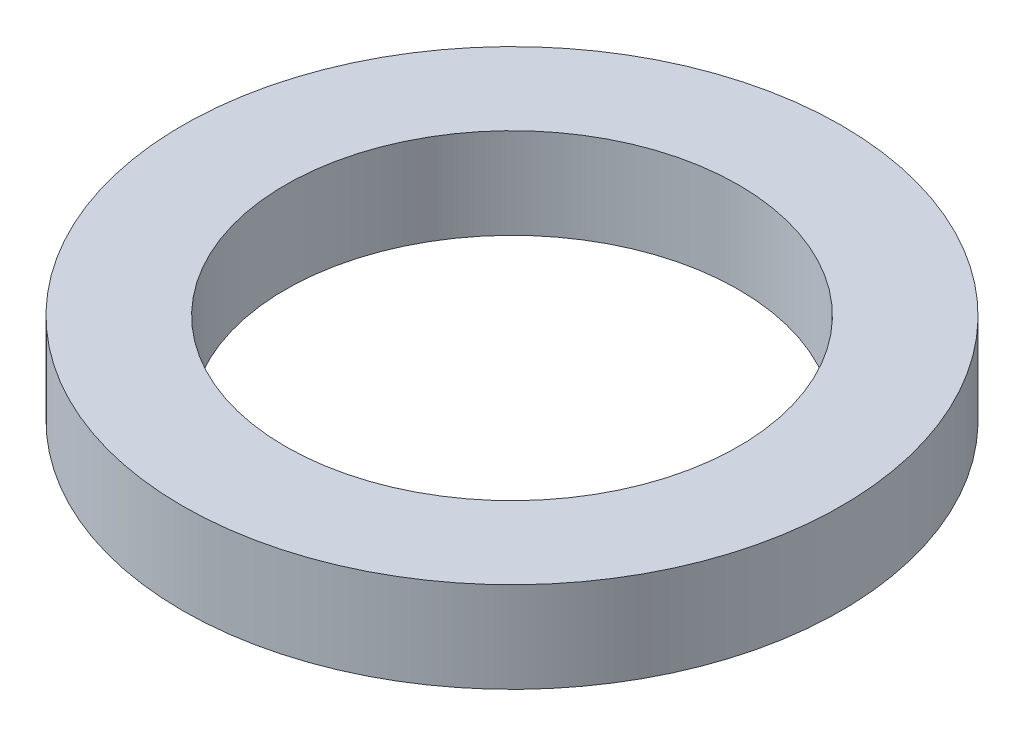
from build123d import *

# Parameters (mm, degrees)
SKETCH1_R           = 40
BOSS_EXTRUDE1_DEPTH = 11
SKETCH2_R           = 27.5
CUT_EXTRUDE1_DEPTH  = 58.628118137


with BuildPart() as part:
    # Sketch1 → Boss-Extrude1 (new body)
    with BuildSketch(Plane(origin=(0, 0, 0), x_dir=(1, 0, 0), z_dir=(0, 1, 0))):
        Circle(SKETCH1_R)
    extrude(amount=BOSS_EXTRUDE1_DEPTH)

    # Sketch2 → Cut-Extrude1 (cut, through all)
    with BuildSketch(Plane(origin=(0, 0, 0), x_dir=(1, 0, 0), z_dir=(0, 1, 0))):
        Circle(SKETCH2_R)
    extrude(amount=CUT_EXTRUDE1_DEPTH, mode=Mode.SUBTRACT)


solid = part.part
